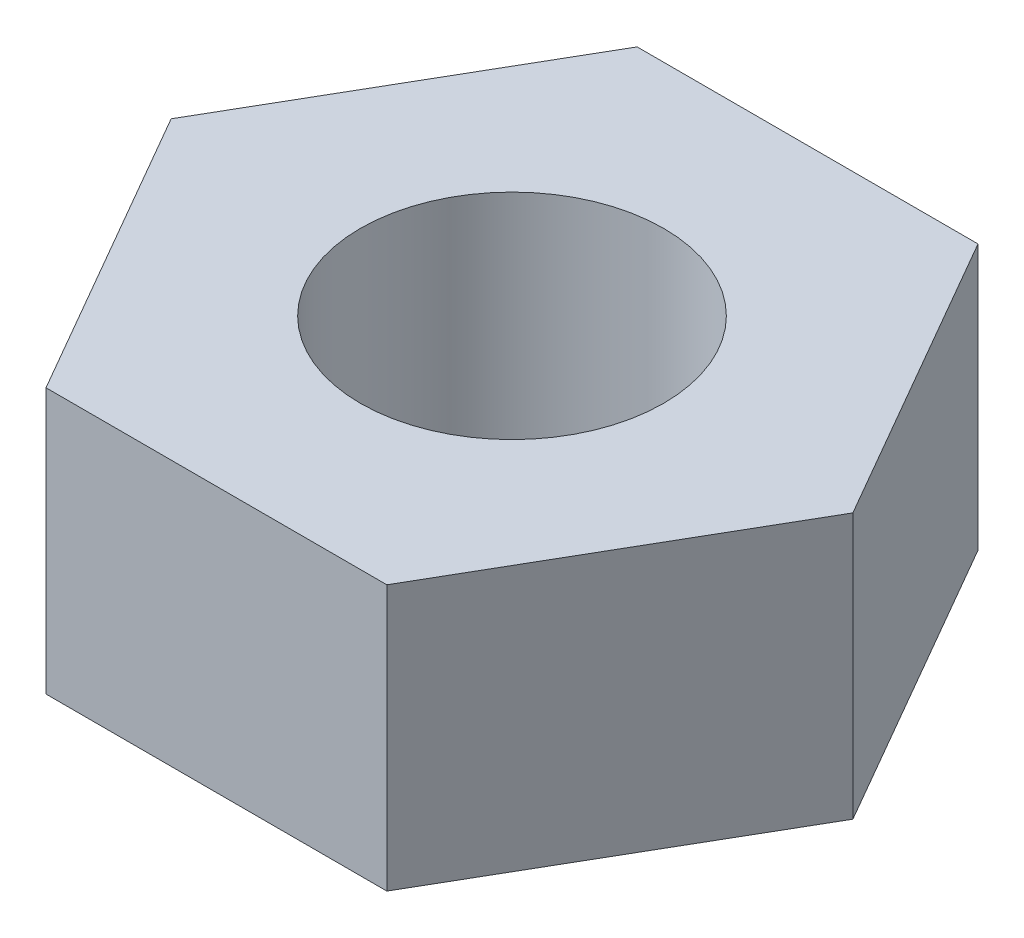
from build123d import *

# Parameters (mm, degrees)
SKETCH_1_R      = 8
EXTRUDE_1_DEPTH = 14


with BuildPart() as part:
    # Эскиз1 → Вытянуть1 (new body)
    with BuildSketch(Plane(origin=(0, 0, 0), x_dir=(1, 0, 0), z_dir=(0, 1, 0))):
        Polygon((8.990253087, -15.594080589), (17.999996483, -0.011252735), (9.009743395, 15.582827855), (-8.990253087, 15.594080589), (-17.999996483, 0.011252735), (-9.009743395, -15.582827855), align=None)
        Circle(SKETCH_1_R, mode=Mode.SUBTRACT)
    extrude(amount=EXTRUDE_1_DEPTH)


solid = part.part
